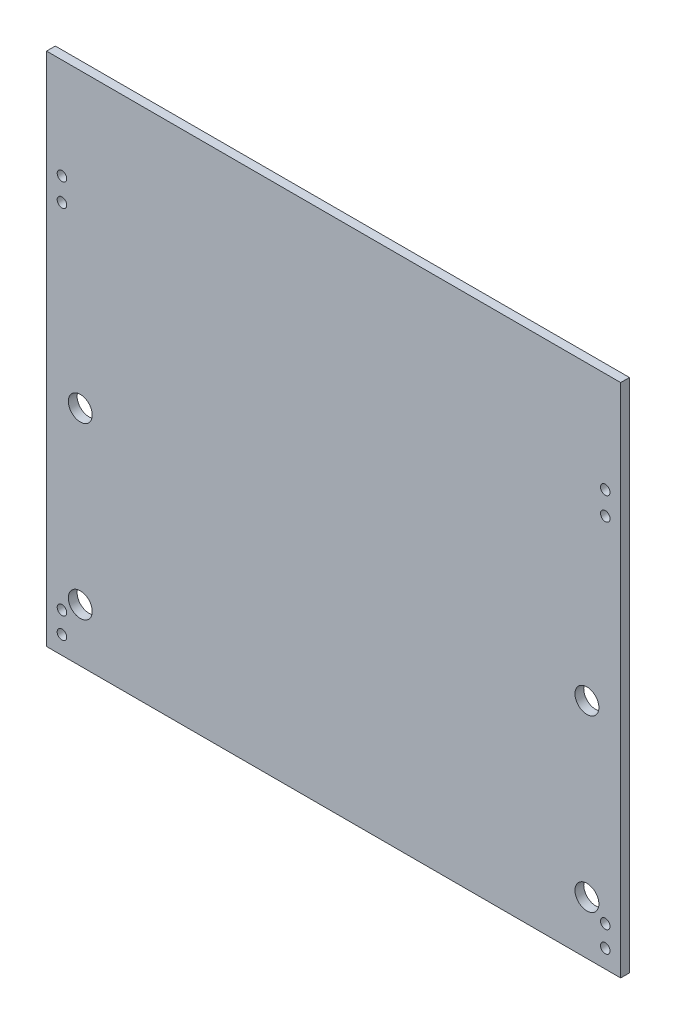
from build123d import *

# Parameters (mm, degrees)
SKETCH1_W           = 216
SKETCH1_H           = 194
SKETCH1_R           = 1.8
SKETCH1_R_2         = 4.5
BOSS_EXTRUDE1_DEPTH = 3.302


with BuildPart() as part:
    # Sketch1 → Boss-Extrude1 (new body)
    with BuildSketch(Plane.XY):
        with Locations((34.846681922, -56.71624714)):
            Rectangle(SKETCH1_W, SKETCH1_H)
        with Locations((-67.353318078, -146.91624714)):
            Circle(SKETCH1_R, mode=Mode.SUBTRACT)
        with Locations((-67.353318078, -138.91624714)):
            Circle(SKETCH1_R, mode=Mode.SUBTRACT)
        with Locations((-67.353318078, -6.11624714)):
            Circle(SKETCH1_R, mode=Mode.SUBTRACT)
        with Locations((137.046681922, 2.48375286)):
            Circle(SKETCH1_R, mode=Mode.SUBTRACT)
        with Locations((137.046681922, -146.91624714)):
            Circle(SKETCH1_R, mode=Mode.SUBTRACT)
        with Locations((137.046681922, -138.91624714)):
            Circle(SKETCH1_R, mode=Mode.SUBTRACT)
        with Locations((137.046681922, -6.11624714)):
            Circle(SKETCH1_R, mode=Mode.SUBTRACT)
        with Locations((-67.353318078, 2.48375286)):
            Circle(SKETCH1_R, mode=Mode.SUBTRACT)
        with Locations((-60.453318078, -133.71624714)):
            Circle(SKETCH1_R_2, mode=Mode.SUBTRACT)
        with Locations((130.146681922, -133.71624714)):
            Circle(SKETCH1_R_2, mode=Mode.SUBTRACT)
        with Locations((-60.453318078, -69.71624714)):
            Circle(SKETCH1_R_2, mode=Mode.SUBTRACT)
        with Locations((130.146681922, -69.71624714)):
            Circle(SKETCH1_R_2, mode=Mode.SUBTRACT)
    extrude(amount=BOSS_EXTRUDE1_DEPTH)


solid = part.part
